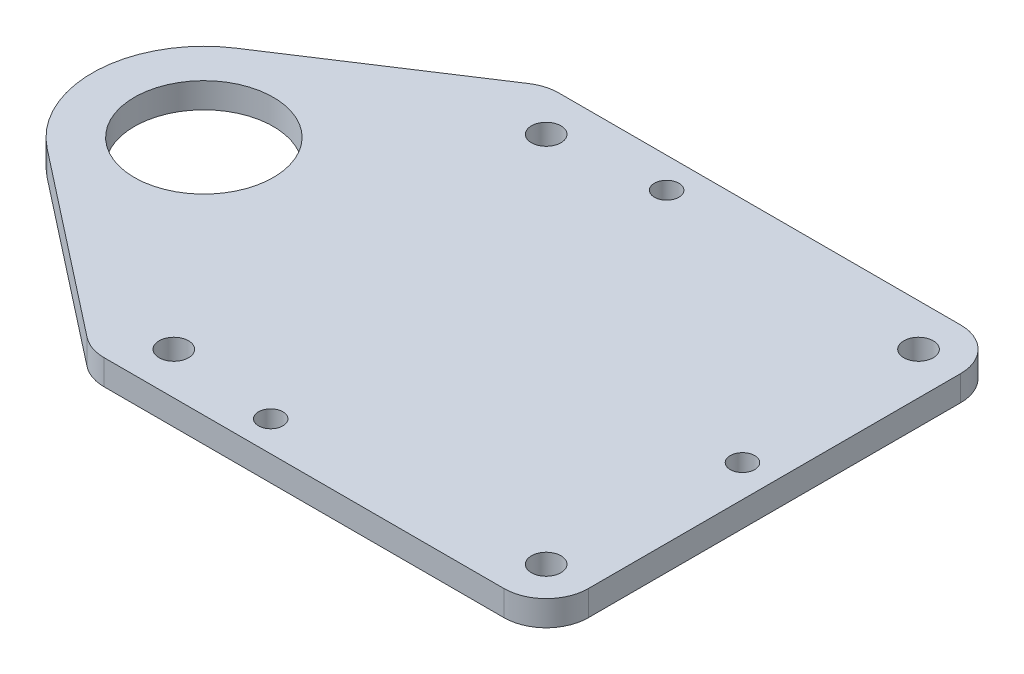
from build123d import *

# Parameters (mm, degrees)
SKETCH1_R           = 1.75
SKETCH1_R_2         = 1.45
SKETCH1_R_3         = 8.25
BOSS_EXTRUDE1_DEPTH = 3
FILLET1_R           = 5


with BuildPart() as part:
    # Sketch1 → Boss-Extrude1 (new body)
    with BuildSketch(Plane(origin=(0, 0, 0), x_dir=(1, 0, 0), z_dir=(0, 1, 0))):
        with BuildLine():
            Line((54.2, 54.2), (0, 54.2))
            Line((0, 54.2), (-22.250600451, 39.652829627))
            ThreePointArc((-22.250600451, 39.652829627), (-28.238044864, 29.125418453), (-23.165599863, 18.127865164))
            Line((-23.165599863, 18.127865164), (0, 0))
            Line((0, 0), (54.2, 0))
            Line((54.2, 0), (54.2, 54.2))
        make_face()
        with Locations((5, 5)):
            Circle(SKETCH1_R, mode=Mode.SUBTRACT)
        with Locations((17.9, 3.6)):
            Circle(SKETCH1_R_2, mode=Mode.SUBTRACT)
        with Locations((49.2, 5)):
            Circle(SKETCH1_R, mode=Mode.SUBTRACT)
        with Locations((5, 49.2)):
            Circle(SKETCH1_R, mode=Mode.SUBTRACT)
        with Locations((50.4, 27.1)):
            Circle(SKETCH1_R_2, mode=Mode.SUBTRACT)
        with Locations((17.9, 50.6)):
            Circle(SKETCH1_R_2, mode=Mode.SUBTRACT)
        with Locations((49.2, 49.2)):
            Circle(SKETCH1_R, mode=Mode.SUBTRACT)
        with Locations((-15, 28.562685665)):
            Circle(SKETCH1_R_3, mode=Mode.SUBTRACT)
    extrude(amount=BOSS_EXTRUDE1_DEPTH)

    # Fillet1
    fillet1_edges = [part.edges().sort_by_distance(p)[0] for p in [
        (54.2, 1.5, -54.2),
        (54.2, 1.5, 0),
        (0, 1.5, 0),
        (0, 1.5, -54.2),
    ]]
    fillet(fillet1_edges, radius=FILLET1_R)


solid = part.part
